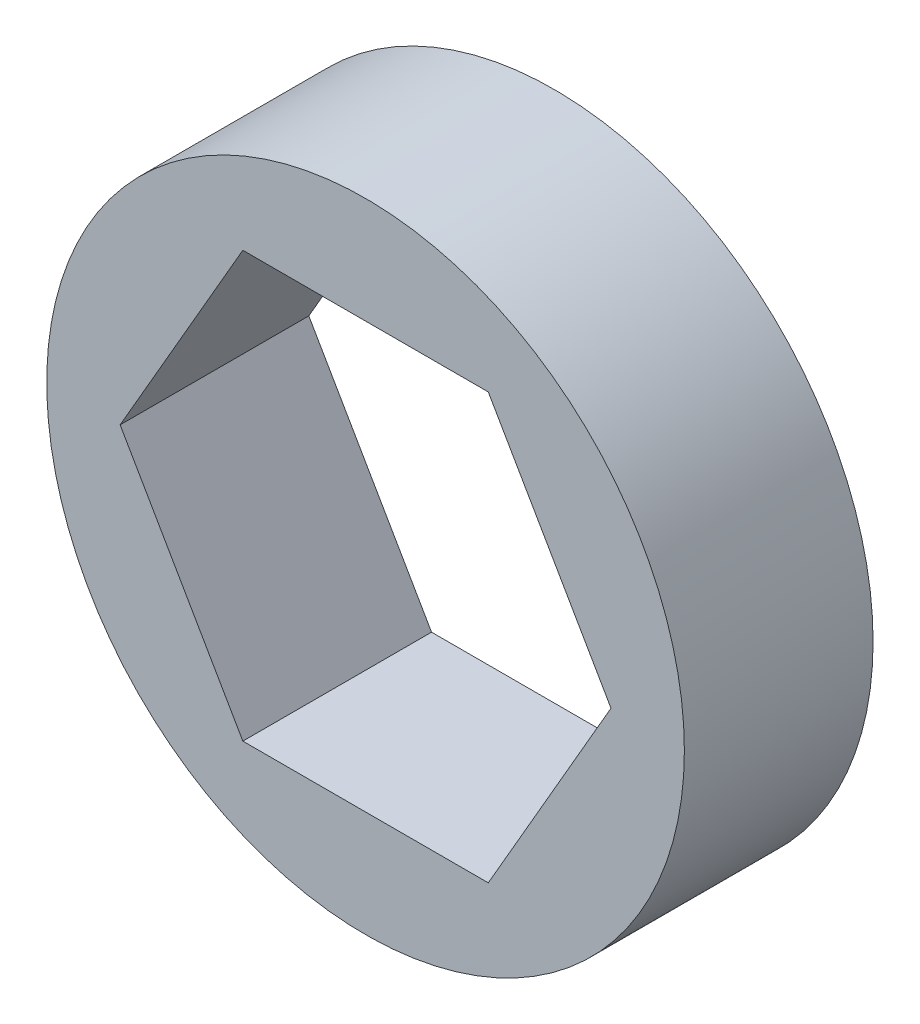
from build123d import *

# Parameters (mm, degrees)
SKETCH1_R           = 9.525
BOSS_EXTRUDE1_DEPTH = 5.63753


with BuildPart() as part:
    # Sketch1 → Boss-Extrude1 (new body)
    with BuildSketch(Plane.XY):
        Circle(SKETCH1_R)
        Polygon((3.666174209, 6.35), (-3.666174209, 6.35), (-7.332348419, 0), (-3.666174209, -6.35), (3.666174209, -6.35), (7.332348419, 0), align=None, mode=Mode.SUBTRACT)
    extrude(amount=BOSS_EXTRUDE1_DEPTH)


solid = part.part
